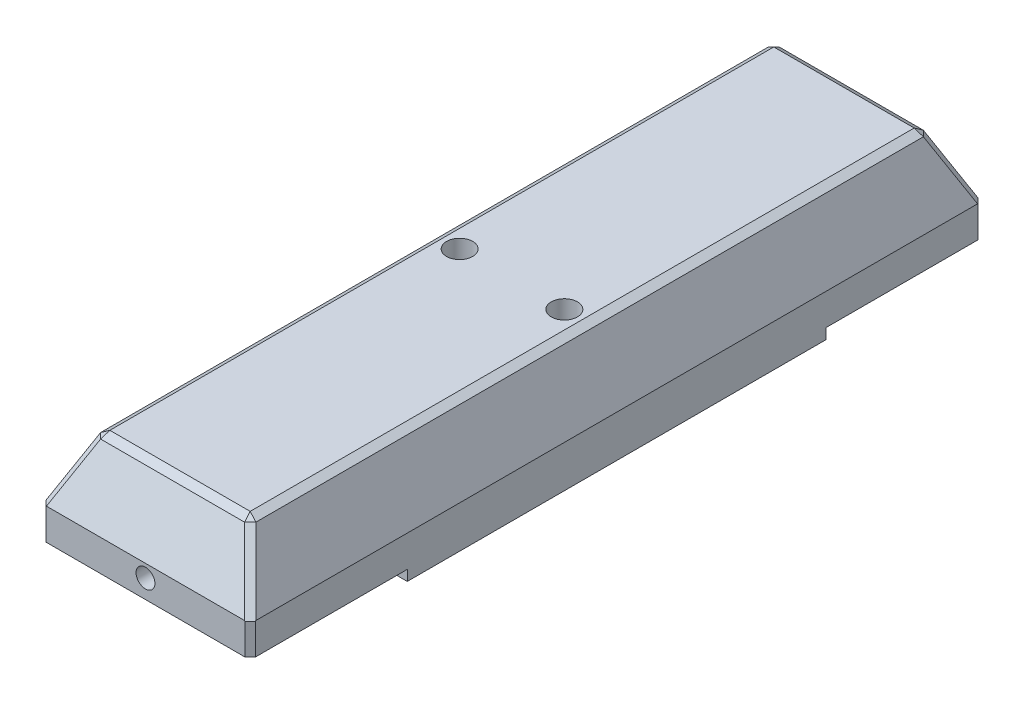
from build123d import *

# Parameters (mm, degrees)
EXTRUDE_1_DEPTH     = 70
CUT_EXTRUDE_1_DEPTH = 74.35529974
SKETCH_3_W          = 18.609369779
SKETCH_3_H          = 2.954088086
EXTRUDE_3_DEPTH     = 15.5
SKETCH_4_W          = 40
SKETCH_4_H          = 1
EXTRUDE_4_DEPTH     = 20
SKETCH_5_R          = 0.9
CUT_EXTRUDE_2_DEPTH = 72.281133549
SKETCH_6_W          = 3.6
SKETCH_6_H          = 3.5
SKETCH_7_R          = 1.25
CUT_EXTRUDE_3_DEPTH = 72.414284285


with BuildPart() as part:
    # ｽｹｯﾁ1 → ﾎﾞｽ - 押し出し1 (new body)
    with BuildSketch(Plane.XY):
        Polygon((-10, 0), (10, 0), (10, 3), (7.202154051, 9), (-7.202154051, 9), (-10, 3), align=None)
    extrude(amount=EXTRUDE_1_DEPTH)

    # ｽｹｯﾁ2 → ｶｯﾄ - 押し出し1 (cut, through all)
    with BuildSketch(Plane(origin=(10, 0, 0), x_dir=(0, 0, -1), z_dir=(1, 0, 0))):
        Polygon((-70, 3), (-67.202154051, 9), (-70, 9), align=None)
        Polygon((-2.797845949, 9), (0, 9), (0, 3), align=None)
    extrude(amount=-CUT_EXTRUDE_1_DEPTH, mode=Mode.SUBTRACT)

    # 面取り1
    # the kernel refuses this chamfer: 0.5 mm, written as the material it takes off along each edge
    with BuildSketch(Plane(origin=(-6.995420754, 8.697897404, 3.004579246), x_dir=(-0.8270486586180938, -0.5268881046463177, -0.19590671622030348), z_dir=(-0.41632572739388457, 0.8082980746110386, -0.41632572739387685))) as chamfer_1_piece_1:
        Polygon((-0.459173014, 0.228990916), (0.400884159, 0.228990916), (0.058288855, -0.457981831), align=None)
    extrude(amount=0.4579583, mode=Mode.SUBTRACT)
    with BuildSketch(Plane(origin=(-6.995420754, 8.697897404, 66.995420754), x_dir=(0.1959067162203077, 0.5268881046463173, -0.8270486586180933), z_dir=(-0.41632572739387774, 0.8082980746110393, 0.4163257273938825))) as chamfer_1_piece_2:
        Polygon((-0.400884159, -0.228990916), (0.459173014, -0.228990916), (-0.058288855, 0.457981831), align=None)
    extrude(amount=0.4579583, mode=Mode.SUBTRACT)
    with BuildSketch(Plane(origin=(6.995420754, 8.697897404, 3.004579246), x_dir=(0.8270486586180947, -0.5268881046463163, -0.1959067162203037), z_dir=(0.4163257273938817, 0.8082980746110384, -0.41632572739387985))) as chamfer_1_piece_3:
        Polygon((-0.459173014, -0.228990916), (0.400884159, -0.228990916), (0.058288855, 0.457981831), align=None)
    extrude(amount=0.4579583, mode=Mode.SUBTRACT)
    with BuildSketch(Plane(origin=(6.995420754, 8.697897404, 66.995420754), x_dir=(-0.19590671622030845, 0.5268881046463186, -0.8270486586180921), z_dir=(0.4163257273938828, 0.8082980746110372, 0.4163257273938814))) as chamfer_1_piece_4:
        Polygon((-0.400884159, 0.228990916), (0.459173014, 0.228990916), (-0.058288855, -0.457981831), align=None)
    extrude(amount=0.4579583, mode=Mode.SUBTRACT)
    with BuildSketch(Plane(origin=(10, -1.285841494, 70), x_dir=(0.02749587661058574, 0, -0.9996219169112968), z_dir=(0, 1, 0)), Plane(origin=(-10, 4.285841494, 70), x_dir=(-0.02749587661058574, 0, -0.9996219169112968), z_dir=(0, -1, 0))) as chamfer_1_piece_5:
        with BuildLine():
            Line((0.514336598, 0), (-0.028273577, 0.513558897))
            Line((-0.028273577, 0.513558897), (-0.038269797, 0.513283938))
            ThreePointArc((-0.038269797, 0.513283938), (-0.017064614, 0.256698915), (-0.009996219, -0.000274959))
            Line((-0.009996219, -0.000274959), (0.000274959, -0.009996219))
            ThreePointArc((0.000274959, -0.009996219), (0.257248832, -0.002927825), (0.514611556, -0.009996219))
            Line((0.514611556, -0.009996219), (0.514336598, 0))
        make_face()
    extrude(amount=5.571682988, mode=Mode.SUBTRACT)
    with BuildSketch(Plane(origin=(-7.202154051, 9, 1.505397137), x_dir=(-0.4413655645980917, -0.8973273864019796, 0), z_dir=(0, 0, 1))) as chamfer_1_piece_6:
        with BuildLine():
            Line((0.516979525, 0), (-0.237770334, 0.459056747))
            Line((-0.237770334, 0.459056747), (-0.246743608, 0.454643091))
            ThreePointArc((-0.246743608, 0.454643091), (-0.123037104, 0.227486173), (-0.008973274, -0.004413656))
            Line((-0.008973274, -0.004413656), (0.000207861, -0.009997839))
            ThreePointArc((0.000207861, -0.009997839), (0.25858594, -0.004626004), (0.517187386, -0.009997839))
            Line((0.517187386, -0.009997839), (0.516979525, 0))
        make_face()
    extrude(amount=66.989205725, mode=Mode.SUBTRACT)
    with BuildSketch(Plane(origin=(7.202154051, 9, 1.505397137), x_dir=(0.441365564598093, -0.897327386401979, 0), z_dir=(0, 0, 1))) as chamfer_1_piece_7:
        with BuildLine():
            Line((0.516979525, 0), (-0.237770334, -0.459056747))
            Line((-0.237770334, -0.459056747), (-0.246743608, -0.454643091))
            ThreePointArc((-0.246743608, -0.454643091), (-0.123037104, -0.227486173), (-0.008973274, 0.004413656))
            Line((-0.008973274, 0.004413656), (0.000207861, 0.009997839))
            ThreePointArc((0.000207861, 0.009997839), (0.25858594, 0.004626004), (0.517187386, 0.009997839))
            Line((0.517187386, 0.009997839), (0.516979525, 0))
        make_face()
    extrude(amount=66.989205725, mode=Mode.SUBTRACT)
    with BuildSketch(Plane(origin=(8.494602863, 9, 67.202154051), x_dir=(0, -0.8973273864019776, 0.4413655645980958), z_dir=(-1, 0, 0))) as chamfer_1_piece_8:
        with BuildLine():
            Line((0.516979525, 0), (-0.237770334, -0.459056747))
            Line((-0.237770334, -0.459056747), (-0.246743608, -0.454643091))
            ThreePointArc((-0.246743608, -0.454643091), (-0.123037104, -0.227486173), (-0.008973274, 0.004413656))
            Line((-0.008973274, 0.004413656), (0.000207861, 0.009997839))
            ThreePointArc((0.000207861, 0.009997839), (0.25858594, 0.004626004), (0.517187386, 0.009997839))
            Line((0.517187386, 0.009997839), (0.516979525, 0))
        make_face()
    extrude(amount=16.989205725, mode=Mode.SUBTRACT)
    with BuildSketch(Plane(origin=(6.700455124, 10.075896822, 66.700455124), x_dir=(0.18700008699946485, -0.3421923931836809, -0.920834042327616), z_dir=(0.38928162063502725, -0.83481712947899, 0.38928162063501803)), Plane(origin=(-10.501698928, 1.924103178, 70.501698928), x_dir=(-0.1870000869994657, -0.34219239318368055, -0.920834042327616), z_dir=(0.38928162063502697, 0.8348171294789901, -0.3892816206350181))) as chamfer_1_piece_9:
        with BuildLine():
            Line((0.515512576, 0), (-0.117174183, -0.502019349))
            Line((-0.117174183, -0.502019349), (-0.126965941, -0.499989208))
            ThreePointArc((-0.126965941, -0.499989208), (-0.062103739, -0.250280562), (-0.009791758, 0.002030141))
            Line((-0.009791758, 0.002030141), (0.000248629, 0.009996909))
            ThreePointArc((0.000248629, 0.009996909), (0.257845581, 0.003590326), (0.515761205, 0.009996909))
            Line((0.515761205, 0.009996909), (0.515512576, 0))
        make_face()
    extrude(amount=9.764765667, mode=Mode.SUBTRACT)
    with BuildSketch(Plane(origin=(6.700455124, 10.075896822, 3.299544876), x_dir=(0.18700008699946544, -0.34219239318368183, 0.9208340423276157), z_dir=(0.38928162063502697, -0.8348171294789896, -0.38928162063501903)), Plane(origin=(-10.501698928, 1.924103178, -0.501698928), x_dir=(-0.18700008699946621, -0.3421923931836814, 0.9208340423276155), z_dir=(0.38928162063502675, 0.8348171294789897, 0.3892816206350191))) as chamfer_1_piece_10:
        with BuildLine():
            Line((0.515512576, 0), (-0.117174183, 0.502019349))
            Line((-0.117174183, 0.502019349), (-0.126965941, 0.499989208))
            ThreePointArc((-0.126965941, 0.499989208), (-0.062103739, 0.250280562), (-0.009791758, -0.002030141))
            Line((-0.009791758, -0.002030141), (0.000248629, -0.009996909))
            ThreePointArc((0.000248629, -0.009996909), (0.257845581, -0.003590326), (0.515761205, -0.009996909))
            Line((0.515761205, -0.009996909), (0.515512576, 0))
        make_face()
    extrude(amount=9.764765667, mode=Mode.SUBTRACT)
    with BuildSketch(Plane(origin=(8.494602863, 9, 2.797845949), x_dir=(0, -0.8973273864019827, -0.44136556459808546), z_dir=(-1, 0, 0))) as chamfer_1_piece_11:
        with BuildLine():
            Line((0.516979525, 0), (-0.237770334, 0.459056747))
            Line((-0.237770334, 0.459056747), (-0.246743608, 0.454643091))
            ThreePointArc((-0.246743608, 0.454643091), (-0.123037104, 0.227486173), (-0.008973274, -0.004413656))
            Line((-0.008973274, -0.004413656), (0.000207861, -0.009997839))
            ThreePointArc((0.000207861, -0.009997839), (0.25858594, -0.004626004), (0.517187386, -0.009997839))
            Line((0.517187386, -0.009997839), (0.516979525, 0))
        make_face()
    extrude(amount=16.989205725, mode=Mode.SUBTRACT)
    with BuildSketch(Plane(origin=(10, -1.285841494, 0), x_dir=(0.02749587661058563, 0, 0.9996219169112968), z_dir=(0, 1, 0)), Plane(origin=(-10, 4.285841494, 0), x_dir=(-0.02749587661058563, 0, 0.9996219169112968), z_dir=(0, -1, 0))) as chamfer_1_piece_12:
        with BuildLine():
            Line((0.514336598, 0), (-0.028273577, -0.513558897))
            Line((-0.028273577, -0.513558897), (-0.038269797, -0.513283938))
            ThreePointArc((-0.038269797, -0.513283938), (-0.017064614, -0.256698915), (-0.009996219, 0.000274959))
            Line((-0.009996219, 0.000274959), (0.000274959, 0.009996219))
            ThreePointArc((0.000274959, 0.009996219), (0.257248832, 0.002927825), (0.514611556, 0.009996219))
            Line((0.514611556, 0.009996219), (0.514336598, 0))
        make_face()
    extrude(amount=5.571682988, mode=Mode.SUBTRACT)

    # ｽｹｯﾁ3 → ﾎﾞｽ - 押し出し3 (add)
    with BuildSketch(Plane.XY.offset(70)):
        with Locations((-0.19531511, 1.477044043)):
            Rectangle(SKETCH_3_W, SKETCH_3_H)
    extrude(amount=-EXTRUDE_3_DEPTH)

    # ｽｹｯﾁ4 → ﾎﾞｽ - 押し出し4 (add)
    with BuildSketch(Plane.ZY.offset(10)):
        with Locations((35, -0.5)):
            Rectangle(SKETCH_4_W, SKETCH_4_H)
    extrude(amount=-EXTRUDE_4_DEPTH)

    # ｽｹｯﾁ5 → ｶｯﾄ - 押し出し2 (cut, through all)
    with BuildSketch(Plane(origin=(0, 0, 0), x_dir=(-1, 0, 0), z_dir=(0, 0, -1))):
        with Locations((0, 1.78)):
            Circle(SKETCH_5_R)
    extrude(amount=-CUT_EXTRUDE_2_DEPTH, mode=Mode.SUBTRACT)

    # ｽｹｯﾁ6 → ｶｯﾄ - 回転1 (revolve, cut)
    with BuildSketch(Plane(origin=(0, 1.78, 0), x_dir=(-1, 0, 0), z_dir=(0, -1, 0))):
        with Locations((1.8, -62)):
            Rectangle(SKETCH_6_W, SKETCH_6_H)
        with Locations((1.8, -8)):
            Rectangle(SKETCH_6_W, SKETCH_6_H)
    revolve(axis=Axis((0, 1.78, 70), (0, 0, -1)), mode=Mode.SUBTRACT)

    # ｽｹｯﾁ7 → ｶｯﾄ - 押し出し3 (cut, through all)
    with BuildSketch(Plane(origin=(0, 9, 0), x_dir=(1, 0, 0), z_dir=(0, 1, 0))):
        with Locations(Location((-5, -35, 0), (0, 0, 180))):
            Circle(SKETCH_7_R)
        with Locations(Location((5, -35, 0), (0, 0, 180))):
            Circle(SKETCH_7_R)
    extrude(amount=-CUT_EXTRUDE_3_DEPTH, mode=Mode.SUBTRACT)


solid = part.part
